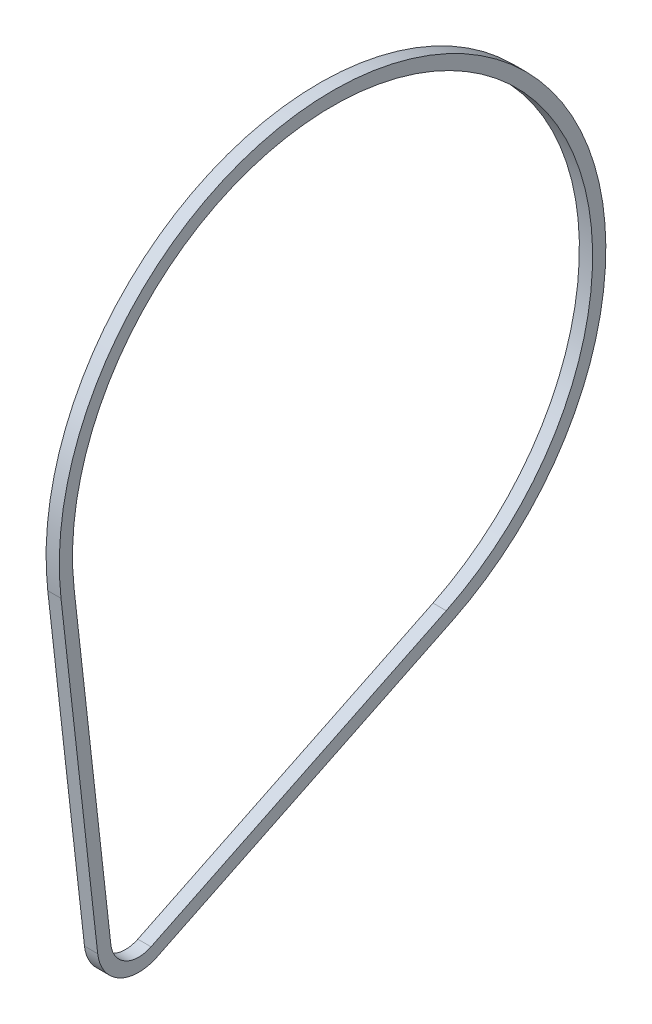
from build123d import *

# Parameters (mm, degrees)
BOSS_EXTRUDE1_DEPTH = 5.08


with BuildPart() as part:
    # Sketch1 → Boss-Extrude1 (new body)
    with BuildSketch(Plane(origin=(0, 0, 0), x_dir=(0, 0, -1), z_dir=(1, 0, 0))):
        with BuildLine():
            Line((117.617771128, 128.035338953), (131.718280332, 2.722061422))
            ThreePointArc((131.718280332, 2.722061422), (139.838359413, -9.410080488), (154.432428486, -9.78115928))
            Line((154.432428486, -9.78115928), (267.853081757, 45.336871318))
            ThreePointArc((267.853081757, 45.336871318), (272.593226177, 231.760877284), (117.617771128, 128.035338953))
        make_face()
        with BuildLine():
            Line((122.665913837, 128.603366413), (136.76642304, 3.290088881))
            ThreePointArc((136.76642304, 3.290088881), (142.288076815, -4.959767617), (152.212043785, -5.212101196))
            Line((152.212043785, -5.212101196), (265.632697056, 49.905929402))
            ThreePointArc((265.632697056, 49.905929402), (270.143508774, 227.310564413), (122.665913837, 128.603366413))
        make_face(mode=Mode.SUBTRACT)
    extrude(amount=BOSS_EXTRUDE1_DEPTH)


solid = part.part
